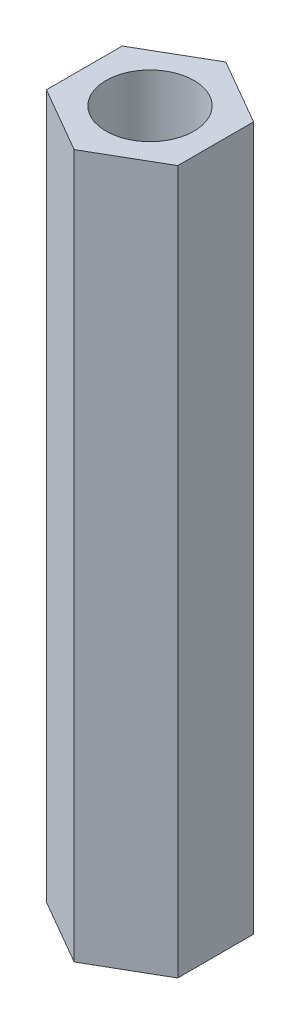
from build123d import *

# Parameters (mm, degrees)
SKETCH1_R           = 1.190625
BOSS_EXTRUDE1_DEPTH = 19.05


with BuildPart() as part:
    # Sketch1 → Boss-Extrude1 (new body)
    with BuildSketch(Plane(origin=(0, 0, 0), x_dir=(1, 0, 0), z_dir=(0, 1, 0))):
        Polygon((0, -2.053057557), (1.778, -1.026528779), (1.778, 1.026528779), (0, 2.053057557), (-1.778, 1.026528779), (-1.778, -1.026528779), align=None)
        Circle(SKETCH1_R, mode=Mode.SUBTRACT)
    extrude(amount=BOSS_EXTRUDE1_DEPTH)


solid = part.part
